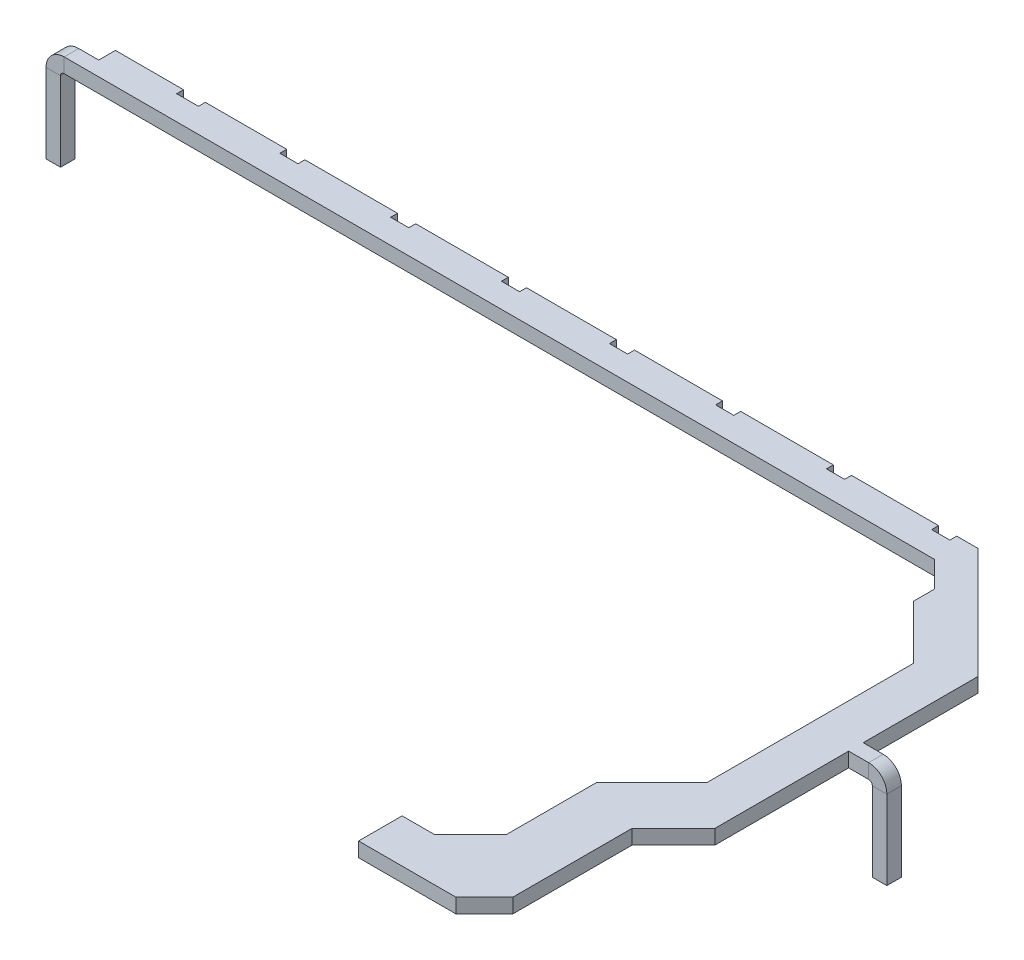
from build123d import *

# Parameters (mm, degrees)
BOSS_EXTRUDE1_DEPTH = 2
EDGE_FLANGE1_DEPTH  = 2
EDGE_FLANGE2_DEPTH  = 2
SKETCH13_W          = 2.5
SKETCH13_H          = 2.15
SKETCH13_W_2        = 3
CUT_EXTRUDE3_DEPTH  = 10


# Sheet-metal steps are written as plain solids
with BuildPart() as part:
    # Sketch2 → Boss-Extrude1 (new body)
    with BuildSketch(Plane(origin=(0, 0, 0), x_dir=(1, 0, 0), z_dir=(0, 1, 0))):
        Polygon((-52.543309772, 32.413356753), (-54.793309772, 32.413356753), (-54.793309772, 30.413356753), (64.413548219, 30.413356753), (67.959993108, 26.866911863), (67.959993108, 23.966910068), (75.359993548, 16.566912168), (75.359993548, -11.849150158), (67.759993508, -19.449150198), (67.759993508, -31.745752353), (62.750836838, -36.754909023), (58.359994528, -36.754909023), (58.359994528, -42.739906444), (71.753176861, -42.739906444), (75.659994488, -38.833088817), (75.659994488, -22.433088597), (81.359993248, -16.733089837), (81.359993248, 1.669814581), (83.609993248, 1.669814581), (83.609993248, 3.669814581), (81.359993248, 3.669814581), (81.359993248, 19.459804242), (66.106440177, 34.713357313), (-52.543309772, 34.713357313), align=None)
    extrude(amount=BOSS_EXTRUDE1_DEPTH)

    # Edge-Flange1 section (across the edge) → Edge-Flange1 (add)
    with BuildSketch(Plane(origin=(-55.793309772, 0, -30.413356753), x_dir=(1, 0, 0), z_dir=(0, 0, -1))):
        with BuildLine():
            Line((-2, 0.5), (-2, 11.4))
            Line((-2, 11.4), (0, 11.4))
            Line((0, 11.4), (0, 0.5))
            ThreePointArc((0, 0.5), (0.146446609, 0.146446609), (0.5, 0))
            Line((0.5, 0), (1, 0))
            Line((1, 0), (1, -2))
            Line((1, -2), (0.5, -2))
            ThreePointArc((0.5, -2), (-1.267766953, -1.267766953), (-2, 0.5))
        make_face()
    extrude(amount=EDGE_FLANGE1_DEPTH)

    # Edge-Flange2 section (across the edge) → Edge-Flange2 (add)
    with BuildSketch(Plane(origin=(84.609993248, 0, -3.669814581), x_dir=(-1, 0, 0), z_dir=(0, 0, 1))):
        with BuildLine():
            Line((-2, 0.5), (-2, 11.4))
            Line((-2, 11.4), (0, 11.4))
            Line((0, 11.4), (0, 0.5))
            ThreePointArc((0, 0.5), (0.146446609, 0.146446609), (0.5, 0))
            Line((0.5, 0), (1, 0))
            Line((1, 0), (1, -2))
            Line((1, -2), (0.5, -2))
            ThreePointArc((0.5, -2), (-1.267766953, -1.267766953), (-2, 0.5))
        make_face()
    extrude(amount=EDGE_FLANGE2_DEPTH)

    # Sketch13 → Cut-Extrude3 (cut)
    with BuildSketch(Plane(origin=(0, 2, 0), x_dir=(1, 0, 0), z_dir=(0, 1, 0))):
        with Locations((-27.730006168, 34.839358373)):
            Rectangle(SKETCH13_W, SKETCH13_H)
        with Locations((-41.672006168, 34.839358373)):
            Rectangle(SKETCH13_W_2, SKETCH13_H)
        with Locations((-12.490006168, 34.839358373)):
            Rectangle(SKETCH13_W, SKETCH13_H)
        with Locations((2.749993832, 34.839358373)):
            Rectangle(SKETCH13_W, SKETCH13_H)
        with Locations((17.608993832, 34.839358373)):
            Rectangle(SKETCH13_W, SKETCH13_H)
        with Locations((32.213993832, 34.839358373)):
            Rectangle(SKETCH13_W, SKETCH13_H)
        with Locations((47.453993832, 34.839358373)):
            Rectangle(SKETCH13_W, SKETCH13_H)
        with Locations((61.931993832, 34.839358373)):
            Rectangle(SKETCH13_W, SKETCH13_H)
    extrude(amount=-CUT_EXTRUDE3_DEPTH, mode=Mode.SUBTRACT)


solid = part.part
